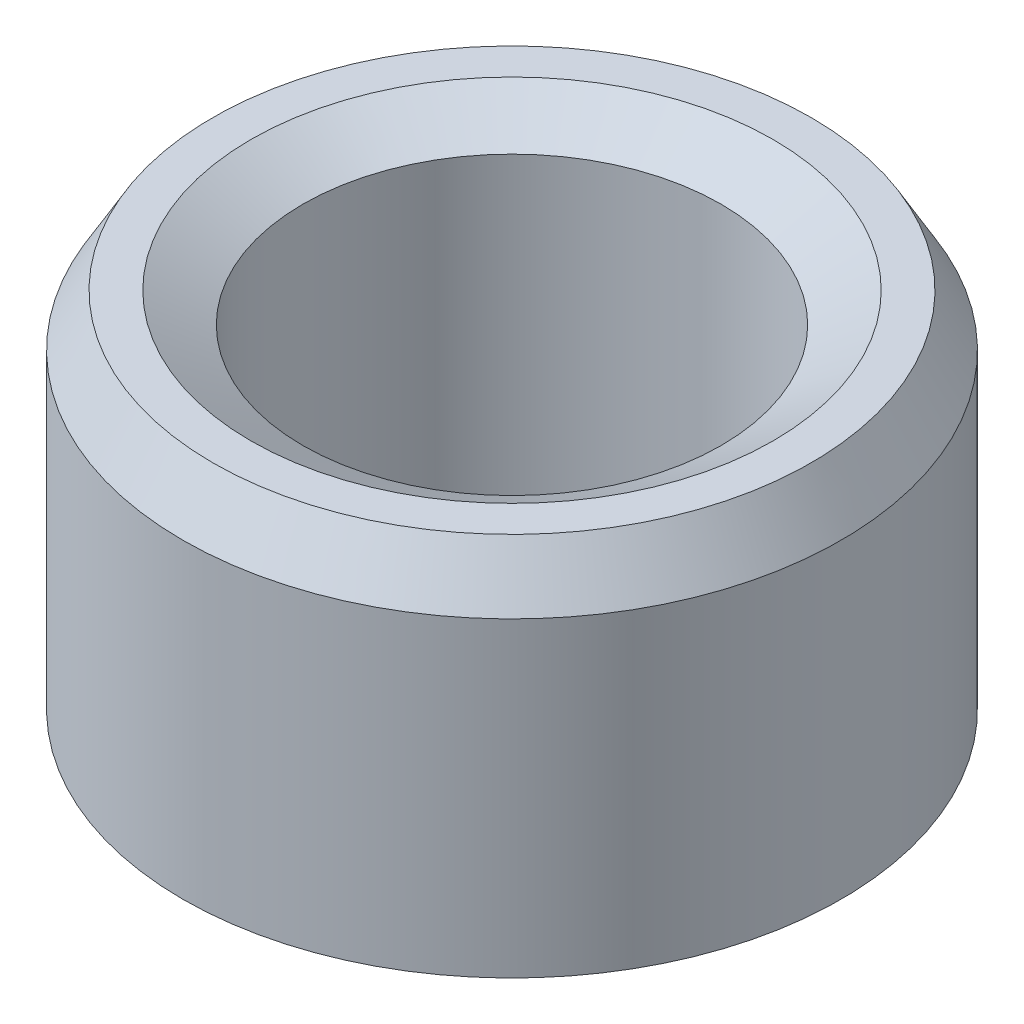
from build123d import *
from OCP.BRepFilletAPI import BRepFilletAPI_MakeChamfer

# Parameters (mm, degrees)
SKETCH1_R           = 17.5
BOSS_EXTRUDE1_DEPTH = 20.894673258
SKETCH2_R           = 11.117771342
CUT_EXTRUDE1_DEPTH  = 33.389618253
CHAMFER1_SIZE       = 2.764334187
CHAMFER1_SIZE2      = 1.595989087


with BuildPart() as part:
    # Sketch1 → Boss-Extrude1 (new body)
    with BuildSketch(Plane(origin=(0, 0, 0), x_dir=(1, 0, 0), z_dir=(0, 1, 0))):
        Circle(SKETCH1_R)
    extrude(amount=BOSS_EXTRUDE1_DEPTH)

    # Sketch2 → Cut-Extrude1 (cut, through all)
    with BuildSketch(Plane(origin=(0, 0, 0), x_dir=(1, 0, 0), z_dir=(0, 1, 0))):
        Circle(SKETCH2_R)
    extrude(amount=CUT_EXTRUDE1_DEPTH, mode=Mode.SUBTRACT)

    # Chamfer1: one chamfer whose edges measure the first distance from different faces: ONE call of the kernel's chamfer builder (chamfer() names one face for all edges)
    chamfer1_edges_1 = [part.edges().sort_by_distance(p)[0] for p in [
        (-11.117771342, 20.894673258, 0),
    ]]
    chamfer1_side_1 = [part.faces().sort_by_distance(p)[0] for p in [
        (-17.005025253, 20.894673258, 0),
    ]]
    chamfer1_edges_2 = [part.edges().sort_by_distance(p)[0] for p in [
        (-11.117771342, 0, 0),
    ]]
    chamfer1_side_2 = [part.faces().sort_by_distance(p)[0] for p in [
        (-11.117771342, 10.447336629, 0),
    ]]
    chamfer1_edges_3 = [part.edges().sort_by_distance(p)[0] for p in [
        (-17.5, 0, 0),
    ]]
    chamfer1_side_3 = [part.faces().sort_by_distance(p)[0] for p in [
        (-17.005025253, 0, 0),
    ]]
    chamfer1_edges_4 = [part.edges().sort_by_distance(p)[0] for p in [
        (-17.5, 20.894673258, 0),
    ]]
    chamfer1_side_4 = [part.faces().sort_by_distance(p)[0] for p in [
        (-17.5, 10.447336629, 0),
    ]]
    chamfer1 = BRepFilletAPI_MakeChamfer(part.part.solid().wrapped)
    for e in chamfer1_edges_1:
        chamfer1.Add(CHAMFER1_SIZE, CHAMFER1_SIZE2, e.wrapped, chamfer1_side_1[0].wrapped)  # the first distance lies on this face
    for e in chamfer1_edges_2:
        chamfer1.Add(CHAMFER1_SIZE, CHAMFER1_SIZE2, e.wrapped, chamfer1_side_2[0].wrapped)  # the first distance lies on this face
    for e in chamfer1_edges_3:
        chamfer1.Add(CHAMFER1_SIZE, CHAMFER1_SIZE2, e.wrapped, chamfer1_side_3[0].wrapped)  # the first distance lies on this face
    for e in chamfer1_edges_4:
        chamfer1.Add(CHAMFER1_SIZE, CHAMFER1_SIZE2, e.wrapped, chamfer1_side_4[0].wrapped)  # the first distance lies on this face
    add(Compound.cast(chamfer1.Shape()), mode=Mode.REPLACE)


solid = part.part
